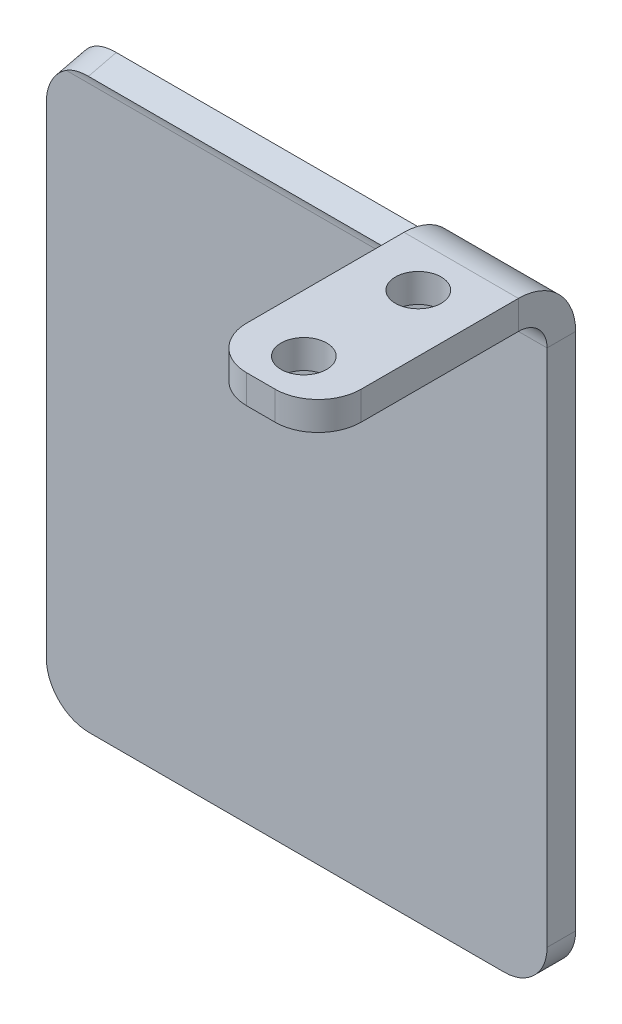
from build123d import *

# Parameters (mm, degrees)
SM_BASE_FLANGE_1_DEPTH = 2
OTHER_START            = -17.5
OTHER_1_DEPTH          = 35
OTHER_1_2_DEPTH        = 35
OTHER_START_2          = 9.5
OTHER_1_3_DEPTH        = 8
CUT_EXTRUDE_1_DEPTH    = 10
FILLET_1_R             = 3


# Read off the part's stored shape, not the designer's step: 绘制的折弯1
# Sheet-metal steps are written as plain solids
with BuildPart() as part:
    # Sketch 1 → 基体-法兰1 (new body)
    with BuildSketch(Plane(origin=(0, 0, 0), x_dir=(1, 0, 0), z_dir=(0, 1, 0))):
        Polygon((-17.5, -20), (9.5, -20), (9.5, -38), (17.5, -38), (17.5, -20), (17.5, 20), (-17.5, 20), align=None)
    extrude(amount=-SM_BASE_FLANGE_1_DEPTH)

    # Other 1 outline → Other 1 (cut)
    with BuildSketch(Plane.YZ.offset(OTHER_START)):
        with BuildLine():
            ThreePointArc((0, 24), (-0.535898385, 22), (-2, 20.535898384))
            Line((-2, 20.535898384), (-2, -20))
            Line((-2, -20), (0, -20))
            Line((0, -20), (0, 24))
        make_face()
    extrude(amount=OTHER_1_DEPTH, mode=Mode.SUBTRACT)



with BuildPart() as body_2:
    # Other 1 2 outline → Other 1 2 (new body)
    with BuildSketch(Plane.YZ.offset(OTHER_START)):
        with BuildLine():
            ThreePointArc((-3.529524853, 22.056124198), (-3.763094539, 22.014080615), (-4, 22))
            Line((-4, 22), (-43.28761102, 22))
            Line((-43.28761102, 22), (-43.28761102, 20))
            Line((-43.28761102, 20), (-4, 20))
            ThreePointArc((-4, 20), (-3.526189079, 20.02816123), (-3.059049707, 20.112248394))
            Line((-3.059049707, 20.112248394), (-3.529524853, 22.056124198))
        make_face()
    extrude(amount=OTHER_1_2_DEPTH)


with BuildPart() as part_1:
    add(part.part)

    add(body_2.part)  # Other 1 3 merges body 2
    # Other 1 3 outline → Other 1 3 (add)
    with BuildSketch(Plane.YZ.offset(OTHER_START_2)):
        with BuildLine():
            ThreePointArc((-2, 24), (-2.428225479, 22.763260394), (-3.529524853, 22.056124198))
            Line((-3.529524853, 22.056124198), (-3.059049707, 20.112248394))
            ThreePointArc((-3.059049707, 20.112248394), (-2.514346277, 20.286129645), (-2, 20.535898384))
            Line((-2, 20.535898384), (-2, 24))
        make_face()
    extrude(amount=OTHER_1_3_DEPTH)

    # 草图7 → 切除-拉伸1 (cut)
    with BuildSketch(Plane.XZ.offset(2)):
        with BuildLine():
            ThreePointArc((15.1, 35), (14.63137085, 36.13137085), (13.5, 36.6))
            Line((13.5, 36.6), (13.5, 35))
            Line((13.5, 35), (13.5, 33.4))
            ThreePointArc((13.5, 33.4), (14.63137085, 33.86862915), (15.1, 35))
        make_face()
        with BuildLine():
            Line((13.5, 35), (13.5, 36.6))
            ThreePointArc((13.5, 36.6), (11.9, 35), (13.5, 33.4))
            Line((13.5, 33.4), (13.5, 35))
        make_face()
        with BuildLine():
            ThreePointArc((15.1, 27), (14.63137085, 28.13137085), (13.5, 28.6))
            Line((13.5, 28.6), (13.5, 27))
            Line((13.5, 27), (13.5, 25.4))
            ThreePointArc((13.5, 25.4), (14.63137085, 25.86862915), (15.1, 27))
        make_face()
        with BuildLine():
            Line((13.5, 27), (13.5, 28.6))
            ThreePointArc((13.5, 28.6), (11.9, 27), (13.5, 25.4))
            Line((13.5, 25.4), (13.5, 27))
        make_face()
    extrude(amount=-CUT_EXTRUDE_1_DEPTH, mode=Mode.SUBTRACT)

    # 圆角1
    fillet_1_edges = [part_1.edges().sort_by_distance(p)[0] for p in [
        (-17.5, -43.28761102, 21),
        (17.5, -43.28761102, 21),
        (17.5, -1, 38),
        (9.5, -1, 38),
        (-17.5, -3.29428728, 21.084186296),
    ]]
    fillet(fillet_1_edges, radius=FILLET_1_R)


solid = part_1.part
